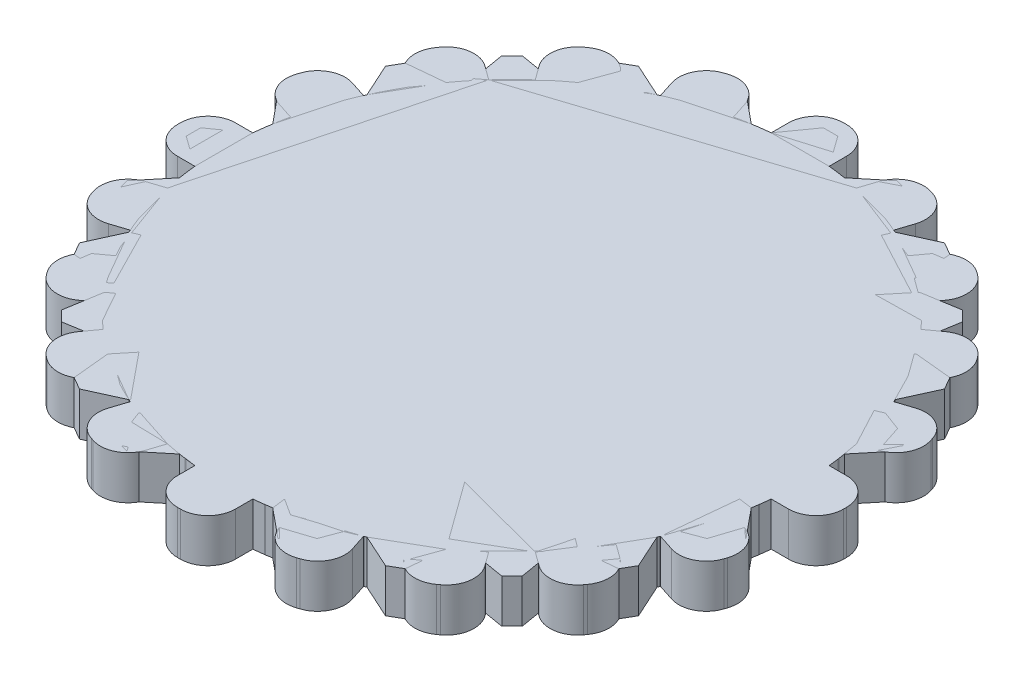
from build123d import *

# Parameters (mm, degrees)
BOSS_EXTRUDE3_DEPTH = 3
BOSS_EXTRUDE5_DEPTH = 3
BOSS_EXTRUDE6_DEPTH = 3
SKETCH4_R           = 6.25
CUT_EXTRUDE1_DEPTH  = 10


with BuildPart() as part:
    # Sketch2 → Boss-Extrude3 (new body)
    with BuildSketch(Plane(origin=(0, 0, 0), x_dir=(1, 0, 0), z_dir=(0, 1, 0))):
        with BuildLine():
            Line((-23, 0.1), (-23, -0.1))
            ThreePointArc((-23, -0.1), (-22.443502884, -1.443502884), (-21.1, -2))
            Line((-21.1, -2), (-19.899748742, -2))
            ThreePointArc((-19.899748742, -2), (-19.753766812, -3.128689301), (-19.543819703, -4.247247513))
            Line((-19.543819703, -4.247247513), (-20.685326483, -4.618145549))
            ThreePointArc((-20.685326483, -4.618145549), (-21.791106589, -5.56257098), (-21.905201574, -7.012285219))
            Line((-21.905201574, -7.012285219), (-21.843398175, -7.202496522))
            ThreePointArc((-21.843398175, -7.202496522), (-20.898972744, -8.308276629), (-19.449258505, -8.422371614))
            Line((-19.449258505, -8.422371614), (-18.307751725, -8.051473578))
            ThreePointArc((-18.307751725, -8.051473578), (-17.820130484, -9.079809995), (-17.274805421, -10.078744846))
            Line((-17.274805421, -10.078744846), (-18.245829086, -10.784234835))
            ThreePointArc((-18.245829086, -10.784234835), (-19.005644954, -12.02414164), (-18.666169396, -13.438159103))
            Line((-18.666169396, -13.438159103), (-18.548612345, -13.599962502))
            ThreePointArc((-18.548612345, -13.599962502), (-17.30870554, -14.35977837), (-15.894688077, -14.020302812))
            Line((-15.894688077, -14.020302812), (-14.923664412, -13.314812824))
            ThreePointArc((-14.923664412, -13.314812824), (-14.142135624, -14.142135624), (-13.314812824, -14.923664412))
            Line((-13.314812824, -14.923664412), (-14.020302812, -15.894688077))
            ThreePointArc((-14.020302812, -15.894688077), (-14.35977837, -17.30870554), (-13.599962502, -18.548612345))
            Line((-13.599962502, -18.548612345), (-13.438159103, -18.666169396))
            ThreePointArc((-13.438159103, -18.666169396), (-12.02414164, -19.005644954), (-10.784234835, -18.245829086))
            Line((-10.784234835, -18.245829086), (-10.078744846, -17.274805421))
            ThreePointArc((-10.078744846, -17.274805421), (-9.079809995, -17.820130484), (-8.051473578, -18.307751725))
            Line((-8.051473578, -18.307751725), (-8.422371614, -19.449258505))
            ThreePointArc((-8.422371614, -19.449258505), (-8.308276629, -20.898972744), (-7.202496522, -21.843398175))
            Line((-7.202496522, -21.843398175), (-7.012285219, -21.905201574))
            ThreePointArc((-7.012285219, -21.905201574), (-5.56257098, -21.791106589), (-4.618145549, -20.685326483))
            Line((-4.618145549, -20.685326483), (-4.247247513, -19.543819703))
            ThreePointArc((-4.247247513, -19.543819703), (-3.128689301, -19.753766812), (-2, -19.899748742))
            Line((-2, -19.899748742), (-2, -21.1))
            ThreePointArc((-2, -21.1), (-1.443502884, -22.443502884), (-0.1, -23))
            Line((-0.1, -23), (0.1, -23))
            ThreePointArc((0.1, -23), (1.443502884, -22.443502884), (2, -21.1))
            Line((2, -21.1), (2, -19.899748742))
            ThreePointArc((2, -19.899748742), (3.128689301, -19.753766812), (4.247247513, -19.543819703))
            Line((4.247247513, -19.543819703), (4.618145549, -20.685326483))
            ThreePointArc((4.618145549, -20.685326483), (5.56257098, -21.791106589), (7.012285219, -21.905201574))
            Line((7.012285219, -21.905201574), (7.202496522, -21.843398175))
            ThreePointArc((7.202496522, -21.843398175), (8.308276629, -20.898972744), (8.422371614, -19.449258505))
            Line((8.422371614, -19.449258505), (8.051473578, -18.307751725))
            ThreePointArc((8.051473578, -18.307751725), (9.079809995, -17.820130484), (10.078744846, -17.274805421))
            Line((10.078744846, -17.274805421), (10.784234835, -18.245829086))
            ThreePointArc((10.784234835, -18.245829086), (12.02414164, -19.005644954), (13.438159103, -18.666169396))
            Line((13.438159103, -18.666169396), (13.599962502, -18.548612345))
            ThreePointArc((13.599962502, -18.548612345), (14.35977837, -17.30870554), (14.020302812, -15.894688077))
            Line((14.020302812, -15.894688077), (13.314812824, -14.923664412))
            ThreePointArc((13.314812824, -14.923664412), (14.142135624, -14.142135624), (14.923664412, -13.314812824))
            Line((14.923664412, -13.314812824), (15.894688077, -14.020302812))
            ThreePointArc((15.894688077, -14.020302812), (17.30870554, -14.35977837), (18.548612345, -13.599962502))
            Line((18.548612345, -13.599962502), (18.666169396, -13.438159103))
            ThreePointArc((18.666169396, -13.438159103), (19.005644954, -12.02414164), (18.245829086, -10.784234835))
            Line((18.245829086, -10.784234835), (17.274805421, -10.078744846))
            ThreePointArc((17.274805421, -10.078744846), (17.820130484, -9.079809995), (18.307751725, -8.051473578))
            Line((18.307751725, -8.051473578), (19.449258505, -8.422371614))
            ThreePointArc((19.449258505, -8.422371614), (20.898972744, -8.308276629), (21.843398175, -7.202496522))
            Line((21.843398175, -7.202496522), (21.905201574, -7.012285219))
            ThreePointArc((21.905201574, -7.012285219), (21.791106589, -5.56257098), (20.685326483, -4.618145549))
            Line((20.685326483, -4.618145549), (19.543819703, -4.247247513))
            ThreePointArc((19.543819703, -4.247247513), (19.753766812, -3.128689301), (19.899748742, -2))
            Line((19.899748742, -2), (21.1, -2))
            ThreePointArc((21.1, -2), (22.443502884, -1.443502884), (23, -0.1))
            Line((23, -0.1), (23, 0.1))
            ThreePointArc((23, 0.1), (22.443502884, 1.443502884), (21.1, 2))
            Line((21.1, 2), (19.899748742, 2))
            ThreePointArc((19.899748742, 2), (19.753766812, 3.128689301), (19.543819703, 4.247247513))
            Line((19.543819703, 4.247247513), (20.685326483, 4.618145549))
            ThreePointArc((20.685326483, 4.618145549), (21.791106589, 5.56257098), (21.905201574, 7.012285219))
            Line((21.905201574, 7.012285219), (21.843398175, 7.202496522))
            ThreePointArc((21.843398175, 7.202496522), (20.898972744, 8.308276629), (19.449258505, 8.422371614))
            Line((19.449258505, 8.422371614), (18.307751725, 8.051473578))
            ThreePointArc((18.307751725, 8.051473578), (17.820130484, 9.079809995), (17.274805421, 10.078744846))
            Line((17.274805421, 10.078744846), (18.245829086, 10.784234835))
            ThreePointArc((18.245829086, 10.784234835), (19.005644954, 12.02414164), (18.666169396, 13.438159103))
            Line((18.666169396, 13.438159103), (18.548612345, 13.599962502))
            ThreePointArc((18.548612345, 13.599962502), (17.30870554, 14.35977837), (15.894688077, 14.020302812))
            Line((15.894688077, 14.020302812), (14.923664412, 13.314812824))
            ThreePointArc((14.923664412, 13.314812824), (14.142135624, 14.142135624), (13.314812824, 14.923664412))
            Line((13.314812824, 14.923664412), (14.020302812, 15.894688077))
            ThreePointArc((14.020302812, 15.894688077), (14.35977837, 17.30870554), (13.599962502, 18.548612345))
            Line((13.599962502, 18.548612345), (13.438159103, 18.666169396))
            ThreePointArc((13.438159103, 18.666169396), (12.02414164, 19.005644954), (10.784234835, 18.245829086))
            Line((10.784234835, 18.245829086), (10.078744846, 17.274805421))
            ThreePointArc((10.078744846, 17.274805421), (9.079809995, 17.820130484), (8.051473578, 18.307751725))
            Line((8.051473578, 18.307751725), (8.422371614, 19.449258505))
            ThreePointArc((8.422371614, 19.449258505), (8.308276629, 20.898972744), (7.202496522, 21.843398175))
            Line((7.202496522, 21.843398175), (7.012285219, 21.905201574))
            ThreePointArc((7.012285219, 21.905201574), (5.56257098, 21.791106589), (4.618145549, 20.685326483))
            Line((4.618145549, 20.685326483), (4.247247513, 19.543819703))
            ThreePointArc((4.247247513, 19.543819703), (3.128689301, 19.753766812), (2, 19.899748742))
            Line((2, 19.899748742), (2, 21.1))
            ThreePointArc((2, 21.1), (1.443502884, 22.443502884), (0.1, 23))
            Line((0.1, 23), (-0.1, 23))
            ThreePointArc((-0.1, 23), (-1.443502884, 22.443502884), (-2, 21.1))
            Line((-2, 21.1), (-2, 19.899748742))
            ThreePointArc((-2, 19.899748742), (-3.128689301, 19.753766812), (-4.247247513, 19.543819703))
            Line((-4.247247513, 19.543819703), (-4.618145549, 20.685326483))
            ThreePointArc((-4.618145549, 20.685326483), (-5.56257098, 21.791106589), (-7.012285219, 21.905201574))
            Line((-7.012285219, 21.905201574), (-7.202496522, 21.843398175))
            ThreePointArc((-7.202496522, 21.843398175), (-8.308276629, 20.898972744), (-8.422371614, 19.449258505))
            Line((-8.422371614, 19.449258505), (-8.051473578, 18.307751725))
            ThreePointArc((-8.051473578, 18.307751725), (-9.079809995, 17.820130484), (-10.078744846, 17.274805421))
            Line((-10.078744846, 17.274805421), (-10.784234835, 18.245829086))
            ThreePointArc((-10.784234835, 18.245829086), (-12.02414164, 19.005644954), (-13.438159103, 18.666169396))
            Line((-13.438159103, 18.666169396), (-13.599962502, 18.548612345))
            ThreePointArc((-13.599962502, 18.548612345), (-14.35977837, 17.30870554), (-14.020302812, 15.894688077))
            Line((-14.020302812, 15.894688077), (-13.314812824, 14.923664412))
            ThreePointArc((-13.314812824, 14.923664412), (-14.142135624, 14.142135624), (-14.923664412, 13.314812824))
            Line((-14.923664412, 13.314812824), (-15.894688077, 14.020302812))
            ThreePointArc((-15.894688077, 14.020302812), (-17.30870554, 14.35977837), (-18.548612345, 13.599962502))
            Line((-18.548612345, 13.599962502), (-18.666169396, 13.438159103))
            ThreePointArc((-18.666169396, 13.438159103), (-19.005644954, 12.02414164), (-18.245829086, 10.784234835))
            Line((-18.245829086, 10.784234835), (-17.274805421, 10.078744846))
            ThreePointArc((-17.274805421, 10.078744846), (-17.820130484, 9.079809995), (-18.307751725, 8.051473578))
            Line((-18.307751725, 8.051473578), (-19.449258505, 8.422371614))
            ThreePointArc((-19.449258505, 8.422371614), (-20.898972744, 8.308276629), (-21.843398175, 7.202496522))
            Line((-21.843398175, 7.202496522), (-21.905201574, 7.012285219))
            ThreePointArc((-21.905201574, 7.012285219), (-21.791106589, 5.56257098), (-20.685326483, 4.618145549))
            Line((-20.685326483, 4.618145549), (-19.543819703, 4.247247513))
            ThreePointArc((-19.543819703, 4.247247513), (-19.753766812, 3.128689301), (-19.899748742, 2))
            Line((-19.899748742, 2), (-21.1, 2))
            ThreePointArc((-21.1, 2), (-22.443502884, 1.443502884), (-23, 0.1))
        make_face()
    extrude(amount=BOSS_EXTRUDE3_DEPTH)


with BuildPart() as body_2:
    # Sketch3 → Boss-Extrude5 (new body)
    with BuildSketch(Plane(origin=(0, 0, 0), x_dir=(1, 0, 0), z_dir=(0, 1, 0))):
        with BuildLine():
            Line((-22, 0.5), (-22, -0.5))
            Line((-22, -0.5), (-19.899748742, -2))
            ThreePointArc((-19.899748742, -2), (-19.828897227, -2.610523844), (-19.739319337, -3.218582315))
            Line((-19.739319337, -3.218582315), (-21.379777701, -5.211056079))
            Line((-21.379777701, -5.211056079), (-21.120958656, -6.176981905))
            Line((-21.120958656, -6.176981905), (-18.704043156, -7.08228562))
            ThreePointArc((-18.704043156, -7.08228562), (-18.47759065, -7.653668647), (-18.23368794, -8.217823563))
            Line((-18.23368794, -8.217823563), (-19.302558883, -10.566987298))
            Line((-19.302558883, -10.566987298), (-18.802558883, -11.433012702))
            Line((-18.802558883, -11.433012702), (-16.23368794, -11.681925179))
            ThreePointArc((-16.23368794, -11.681925179), (-15.867066806, -12.17522858), (-15.485460842, -12.657033717))
            Line((-15.485460842, -12.657033717), (-15.909902577, -15.202795796))
            Line((-15.909902577, -15.202795796), (-15.202795796, -15.909902577))
            Line((-15.202795796, -15.909902577), (-12.657033717, -15.485460842))
            ThreePointArc((-12.657033717, -15.485460842), (-12.17522858, -15.867066806), (-11.681925179, -16.23368794))
            Line((-11.681925179, -16.23368794), (-11.433012702, -18.802558883))
            Line((-11.433012702, -18.802558883), (-10.566987298, -19.302558883))
            Line((-10.566987298, -19.302558883), (-8.217823563, -18.23368794))
            ThreePointArc((-8.217823563, -18.23368794), (-7.653668647, -18.47759065), (-7.08228562, -18.704043156))
            Line((-7.08228562, -18.704043156), (-6.176981905, -21.120958656))
            Line((-6.176981905, -21.120958656), (-5.211056079, -21.379777701))
            Line((-5.211056079, -21.379777701), (-3.218582315, -19.739319337))
            ThreePointArc((-3.218582315, -19.739319337), (-2.610523844, -19.828897227), (-2, -19.899748742))
            Line((-2, -19.899748742), (-0.5, -22))
            Line((-0.5, -22), (0.5, -22))
            Line((0.5, -22), (2, -19.899748742))
            ThreePointArc((2, -19.899748742), (2.610523844, -19.828897227), (3.218582315, -19.739319337))
            Line((3.218582315, -19.739319337), (5.211056079, -21.379777701))
            Line((5.211056079, -21.379777701), (6.176981905, -21.120958656))
            Line((6.176981905, -21.120958656), (7.08228562, -18.704043156))
            ThreePointArc((7.08228562, -18.704043156), (7.653668647, -18.47759065), (8.217823563, -18.23368794))
            Line((8.217823563, -18.23368794), (10.566987298, -19.302558883))
            Line((10.566987298, -19.302558883), (11.433012702, -18.802558883))
            Line((11.433012702, -18.802558883), (11.681925179, -16.23368794))
            ThreePointArc((11.681925179, -16.23368794), (12.17522858, -15.867066806), (12.657033717, -15.485460842))
            Line((12.657033717, -15.485460842), (15.202795796, -15.909902577))
            Line((15.202795796, -15.909902577), (15.909902577, -15.202795796))
            Line((15.909902577, -15.202795796), (15.485460842, -12.657033717))
            ThreePointArc((15.485460842, -12.657033717), (15.867066806, -12.17522858), (16.23368794, -11.681925179))
            Line((16.23368794, -11.681925179), (18.802558883, -11.433012702))
            Line((18.802558883, -11.433012702), (19.302558883, -10.566987298))
            Line((19.302558883, -10.566987298), (18.23368794, -8.217823563))
            ThreePointArc((18.23368794, -8.217823563), (18.47759065, -7.653668647), (18.704043156, -7.08228562))
            Line((18.704043156, -7.08228562), (21.120958656, -6.176981905))
            Line((21.120958656, -6.176981905), (21.379777701, -5.211056079))
            Line((21.379777701, -5.211056079), (19.739319337, -3.218582315))
            ThreePointArc((19.739319337, -3.218582315), (19.828897227, -2.610523844), (19.899748742, -2))
            Line((19.899748742, -2), (22, -0.5))
            Line((22, -0.5), (22, 0.5))
            Line((22, 0.5), (19.899748742, 2))
            ThreePointArc((19.899748742, 2), (19.828897227, 2.610523844), (19.739319337, 3.218582315))
            Line((19.739319337, 3.218582315), (21.379777701, 5.211056079))
            Line((21.379777701, 5.211056079), (21.120958656, 6.176981905))
            Line((21.120958656, 6.176981905), (18.704043156, 7.08228562))
            ThreePointArc((18.704043156, 7.08228562), (18.47759065, 7.653668647), (18.23368794, 8.217823563))
            Line((18.23368794, 8.217823563), (19.302558883, 10.566987298))
            Line((19.302558883, 10.566987298), (18.802558883, 11.433012702))
            Line((18.802558883, 11.433012702), (16.23368794, 11.681925179))
            ThreePointArc((16.23368794, 11.681925179), (15.867066806, 12.17522858), (15.485460842, 12.657033717))
            Line((15.485460842, 12.657033717), (15.909902577, 15.202795796))
            Line((15.909902577, 15.202795796), (15.202795796, 15.909902577))
            Line((15.202795796, 15.909902577), (12.657033717, 15.485460842))
            ThreePointArc((12.657033717, 15.485460842), (12.17522858, 15.867066806), (11.681925179, 16.23368794))
            Line((11.681925179, 16.23368794), (11.433012702, 18.802558883))
            Line((11.433012702, 18.802558883), (10.566987298, 19.302558883))
            Line((10.566987298, 19.302558883), (8.217823563, 18.23368794))
            ThreePointArc((8.217823563, 18.23368794), (7.653668647, 18.47759065), (7.08228562, 18.704043156))
            Line((7.08228562, 18.704043156), (6.176981905, 21.120958656))
            Line((6.176981905, 21.120958656), (5.211056079, 21.379777701))
            Line((5.211056079, 21.379777701), (3.218582315, 19.739319337))
            ThreePointArc((3.218582315, 19.739319337), (2.610523844, 19.828897227), (2, 19.899748742))
            Line((2, 19.899748742), (0.5, 22))
            Line((0.5, 22), (-0.5, 22))
            Line((-0.5, 22), (-2, 19.899748742))
            ThreePointArc((-2, 19.899748742), (-2.610523844, 19.828897227), (-3.218582315, 19.739319337))
            Line((-3.218582315, 19.739319337), (-5.211056079, 21.379777701))
            Line((-5.211056079, 21.379777701), (-6.176981905, 21.120958656))
            Line((-6.176981905, 21.120958656), (-7.08228562, 18.704043156))
            ThreePointArc((-7.08228562, 18.704043156), (-7.653668647, 18.47759065), (-8.217823563, 18.23368794))
            Line((-8.217823563, 18.23368794), (-10.566987298, 19.302558883))
            Line((-10.566987298, 19.302558883), (-11.433012702, 18.802558883))
            Line((-11.433012702, 18.802558883), (-11.681925179, 16.23368794))
            ThreePointArc((-11.681925179, 16.23368794), (-12.17522858, 15.867066806), (-12.657033717, 15.485460842))
            Line((-12.657033717, 15.485460842), (-15.202795796, 15.909902577))
            Line((-15.202795796, 15.909902577), (-15.909902577, 15.202795796))
            Line((-15.909902577, 15.202795796), (-15.485460842, 12.657033717))
            ThreePointArc((-15.485460842, 12.657033717), (-15.867066806, 12.17522858), (-16.23368794, 11.681925179))
            Line((-16.23368794, 11.681925179), (-18.802558883, 11.433012702))
            Line((-18.802558883, 11.433012702), (-19.302558883, 10.566987298))
            Line((-19.302558883, 10.566987298), (-18.23368794, 8.217823563))
            ThreePointArc((-18.23368794, 8.217823563), (-18.47759065, 7.653668647), (-18.704043156, 7.08228562))
            Line((-18.704043156, 7.08228562), (-21.120958656, 6.176981905))
            Line((-21.120958656, 6.176981905), (-21.379777701, 5.211056079))
            Line((-21.379777701, 5.211056079), (-19.739319337, 3.218582315))
            ThreePointArc((-19.739319337, 3.218582315), (-19.828897227, 2.610523844), (-19.899748742, 2))
            Line((-19.899748742, 2), (-22, 0.5))
        make_face()
    extrude(amount=BOSS_EXTRUDE5_DEPTH)

    # Sketch4 → Cut-Extrude1 (cut)
    with BuildSketch(Plane(origin=(0, 3, 0), x_dir=(1, 0, 0), z_dir=(0, 1, 0))):
        Circle(SKETCH4_R)
    extrude(amount=-CUT_EXTRUDE1_DEPTH, mode=Mode.SUBTRACT)


with BuildPart() as body_3:
    # Sketch1 → Boss-Extrude6 (new body)
    with BuildSketch(Plane(origin=(0, 0, 0), x_dir=(1, 0, 0), z_dir=(0, 1, 0))):
        with BuildLine():
            Line((-0.5, 14.746169466), (0.5, 14.746169466))
            Line((0.5, 14.746169466), (2, 12.544128437))
            ThreePointArc((2, 12.544128437), (2.588190451, 12.405427729), (3.166928678, 12.23145084))
            Line((3.166928678, 12.23145084), (5.566987298, 13.388474311))
            Line((5.566987298, 13.388474311), (6.433012702, 12.888474311))
            Line((6.433012702, 12.888474311), (6.631030293, 10.23145084))
            ThreePointArc((6.631030293, 10.23145084), (7.071067812, 9.817237278), (7.485281374, 9.377199759))
            Line((7.485281374, 9.377199759), (10.142304845, 9.179182168))
            Line((10.142304845, 9.179182168), (10.642304845, 8.313156764))
            Line((10.642304845, 8.313156764), (9.485281374, 5.913098144))
            ThreePointArc((9.485281374, 5.913098144), (9.659258263, 5.334359917), (9.797958971, 4.746169466))
            Line((9.797958971, 4.746169466), (12, 3.246169466))
            Line((12, 3.246169466), (12, 2.246169466))
            Line((12, 2.246169466), (9.797958971, 0.746169466))
            ThreePointArc((9.797958971, 0.746169466), (9.659258263, 0.157979015), (9.485281374, -0.420759212))
            Line((9.485281374, -0.420759212), (10.642304845, -2.820817832))
            Line((10.642304845, -2.820817832), (10.142304845, -3.686843236))
            Line((10.142304845, -3.686843236), (7.485281374, -3.884860827))
            ThreePointArc((7.485281374, -3.884860827), (7.071067812, -4.324898346), (6.631030293, -4.739111908))
            Line((6.631030293, -4.739111908), (6.433012702, -7.39613538))
            Line((6.433012702, -7.39613538), (5.566987298, -7.89613538))
            Line((5.566987298, -7.89613538), (3.166928678, -6.739111908))
            ThreePointArc((3.166928678, -6.739111908), (2.588190451, -6.913088797), (2, -7.051789505))
            Line((2, -7.051789505), (0.5, -9.253830534))
            Line((0.5, -9.253830534), (-0.5, -9.253830534))
            Line((-0.5, -9.253830534), (-2, -7.051789505))
            ThreePointArc((-2, -7.051789505), (-2.588190451, -6.913088797), (-3.166928678, -6.739111908))
            Line((-3.166928678, -6.739111908), (-5.566987298, -7.89613538))
            Line((-5.566987298, -7.89613538), (-6.433012702, -7.39613538))
            Line((-6.433012702, -7.39613538), (-6.631030293, -4.739111908))
            ThreePointArc((-6.631030293, -4.739111908), (-7.071067812, -4.324898346), (-7.485281374, -3.884860827))
            Line((-7.485281374, -3.884860827), (-10.142304845, -3.686843236))
            Line((-10.142304845, -3.686843236), (-10.642304845, -2.820817832))
            Line((-10.642304845, -2.820817832), (-9.485281374, -0.420759212))
            ThreePointArc((-9.485281374, -0.420759212), (-9.659258263, 0.157979015), (-9.797958971, 0.746169466))
            Line((-9.797958971, 0.746169466), (-12, 2.246169466))
            Line((-12, 2.246169466), (-12, 3.246169466))
            Line((-12, 3.246169466), (-9.797958971, 4.746169466))
            ThreePointArc((-9.797958971, 4.746169466), (-9.659258263, 5.334359917), (-9.485281374, 5.913098144))
            Line((-9.485281374, 5.913098144), (-10.642304845, 8.313156764))
            Line((-10.642304845, 8.313156764), (-10.142304845, 9.179182168))
            Line((-10.142304845, 9.179182168), (-7.485281374, 9.377199759))
            ThreePointArc((-7.485281374, 9.377199759), (-7.071067812, 9.817237278), (-6.631030293, 10.23145084))
            Line((-6.631030293, 10.23145084), (-6.433012702, 12.888474311))
            Line((-6.433012702, 12.888474311), (-5.566987298, 13.388474311))
            Line((-5.566987298, 13.388474311), (-3.166928678, 12.23145084))
            ThreePointArc((-3.166928678, 12.23145084), (-2.588190451, 12.405427729), (-2, 12.544128437))
            Line((-2, 12.544128437), (-0.5, 14.746169466))
        make_face()
    extrude(amount=BOSS_EXTRUDE6_DEPTH)


solid = Compound([part.part, body_2.part, body_3.part])
